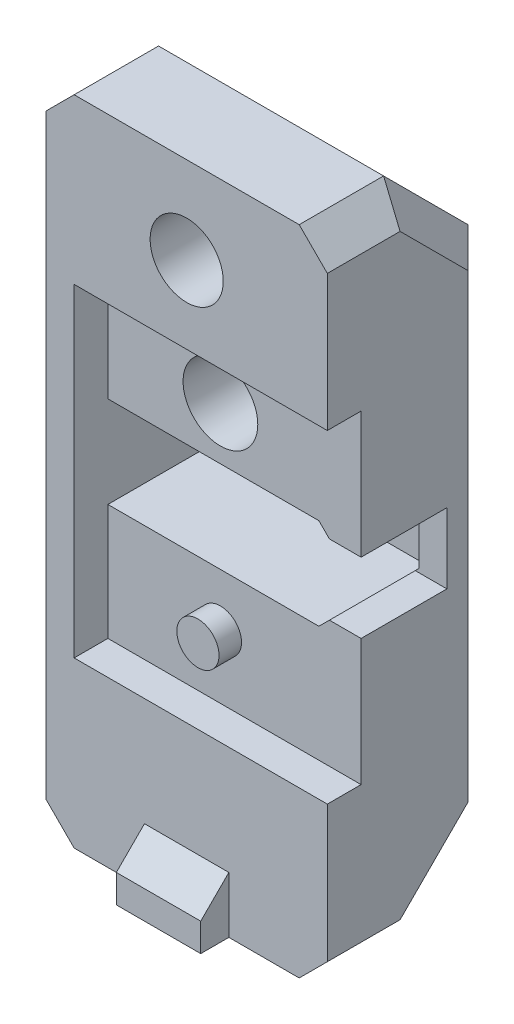
from build123d import *

# Parameters (mm, degrees)
SKETCH1_W            = 20
SKETCH1_H            = 46.382365304
SKETCH1_R            = 2.6
SKETCH1_R_2          = 1.75
SKETCH1_R_3          = 2.75
BOSS_EXTRUDE2_DEPTH  = 2
SKETCH2_R            = 2.6
BOSS_EXTRUDE3_DEPTH  = 10
SKETCH4_R            = 1.75
BOSS_EXTRUDE5_DEPTH  = 2
SKETCH5_R            = 4.5
CUT_EXTRUDE1_DEPTH   = 5
SKETCH3_W            = 18
SKETCH3_H            = 8.25
SKETCH3_R            = 1.75
BOSS_EXTRUDE9_DEPTH  = 7.6
SKETCH8_R            = 2.55
CUT_EXTRUDE3_DEPTH   = 3.8
CHAMFER5_SIZE2       = 3.8
CHAMFER5_SIZE        = 0.105
CHAMFER6_SIZE        = 6
CHAMFER7_SIZE        = 2
SKETCH9_W            = 2
SKETCH9_H            = 6.5
BOSS_EXTRUDE10_DEPTH = 1.5
SKETCH10_W           = 2
SKETCH10_H           = 0.75
BOSS_EXTRUDE11_DEPTH = 6.1
CHAMFER8_SIZE        = 1
SKETCH13_R           = 1.875965007
BOSS_EXTRUDE14_DEPTH = 7.6
SKETCH12_R           = 1.5
BOSS_EXTRUDE15_DEPTH = 1.6
SKETCH14_W           = 6
SKETCH14_H           = 4
BOSS_EXTRUDE16_DEPTH = 2
CHAMFER9_SIZE        = 2


# Some blends are built 0.0001 mm under size
with BuildPart() as part:
    # Sketch1 → Boss-Extrude2 (new body)
    with BuildSketch(Plane.XY):
        with Locations((-1.1970966, -0.016031908)):
            Rectangle(SKETCH1_W, SKETCH1_H)
        with Locations((-1.1970966, 16.983968092)):
            Circle(SKETCH1_R, mode=Mode.SUBTRACT)
        with Locations((-1.1970966, 7)):
            Circle(SKETCH1_R_2, mode=Mode.SUBTRACT)
        with Locations((-1.1970966, 0)):
            Circle(SKETCH1_R_3, mode=Mode.SUBTRACT)
    extrude(amount=BOSS_EXTRUDE2_DEPTH)

    # Sketch2 → Boss-Extrude3 (add)
    with BuildSketch(Plane.XY.offset(2)):
        Polygon((-11.1970966, 23.175150744), (-11.1970966, -23.20721456), (8.8029034, -23.20721456), (8.8029034, -11.5), (-9.1970966, -11.5), (-9.1970966, 11.5), (8.8029034, 11.5), (8.8029034, 23.175150744), align=None)
        with Locations((-1.1970966, 16.983968092)):
            Circle(SKETCH2_R, mode=Mode.SUBTRACT)
    extrude(amount=BOSS_EXTRUDE3_DEPTH)

    # Sketch4 → Boss-Extrude5 (add)
    with BuildSketch(Plane(origin=(0, 0, 0), x_dir=(-1, 0, 0), z_dir=(0, 0, -1))):
        with Locations((1.1970966, 7)):
            Circle(SKETCH4_R)
    extrude(amount=-BOSS_EXTRUDE5_DEPTH)

    # Sketch5 → Cut-Extrude1 (cut)
    with BuildSketch(Plane(origin=(0, 0, 0), x_dir=(-1, 0, 0), z_dir=(0, 0, -1))):
        with Locations((1.1970966, 16.983968092)):
            Circle(SKETCH5_R)
    extrude(amount=-CUT_EXTRUDE1_DEPTH, mode=Mode.SUBTRACT)

    # Sketch3 → Boss-Extrude9 (add)
    # profile 1 of 2: a face of its own
    with BuildSketch(Plane.XY.offset(2)):
        with Locations((-0.1970966, -7.375)):
            Rectangle(SKETCH3_W, SKETCH3_H)
        with Locations(Location((-1.1970966, -7, 0), (0, 0, 180))):
            Circle(SKETCH3_R, mode=Mode.SUBTRACT)
    # profile 2 of 2: a face of its own
    with BuildSketch(Plane.XY.offset(2)):
        with Locations((-0.1970966, 7.375)):
            Rectangle(SKETCH3_W, SKETCH3_H)
        with Locations(Location((-1.1970966, 7, 0), (0, 0, 180))):
            Circle(SKETCH3_R, mode=Mode.SUBTRACT)
    extrude(amount=BOSS_EXTRUDE9_DEPTH)

    # Sketch8 → Cut-Extrude3 (cut)
    with BuildSketch(Plane.XY.offset(9.6)):
        with Locations((-1.1970966, 7)):
            Circle(SKETCH8_R)
    extrude(amount=-CUT_EXTRUDE3_DEPTH, mode=Mode.SUBTRACT)

    # Chamfer5
    chamfer5_edges = [part.edges().sort_by_distance(p)[0] for p in [
        (-3.7470966, 7, 9.6),
    ]]
    chamfer5_side = [part.faces().sort_by_distance(p)[0] for p in [
        (-3.7491966, 7, 9.6),
    ]]
    chamfer(chamfer5_edges, length=CHAMFER5_SIZE - 0.0001, length2=CHAMFER5_SIZE2 - 0.0001, reference=chamfer5_side[0])  # a hair under: the kernel refuses the full size

    # Chamfer6
    # the kernel refuses this chamfer: 6 mm, written as the material it takes off along each edge
    with BuildSketch(Plane(origin=(-26.627194528, 23.175150744, 0), x_dir=(0, 0.027495876610586202, 0.9996219169112968), z_dir=(1, 0, 0)), Plane(origin=(24.233001328, -23.20721456, 0), x_dir=(0, -0.027495876610586202, 0.9996219169112968), z_dir=(-1, 0, 0))) as chamfer6_piece_1:
        Polygon((CHAMFER6_SIZE * 0.999621916911, CHAMFER6_SIZE * 0.0274958766106), (-CHAMFER6_SIZE * 0.0274958766106, CHAMFER6_SIZE * 0.999621916911), (0, 0), align=None)
    extrude(amount=50.860195856, mode=Mode.SUBTRACT)

    # Chamfer7
    chamfer7_edges = [part.edges().sort_by_distance(p)[0] for p in [
        (-11.1970966, -0.016031908, 0),
        (8.8029034, -0.016031908, 0),
        (8.8029034, -20.20721456, 3),
        (8.8029034, 20.175150744, 3),
        (-11.1970966, -20.20721456, 3),
        (-11.1970966, 20.175150744, 3),
        (-11.1970966, -23.20721456, 9),
        (-11.1970966, 23.175150744, 9),
        (8.8029034, 23.175150744, 9),
        (8.8029034, -23.20721456, 9),
    ]]
    chamfer(chamfer7_edges, length=CHAMFER7_SIZE - 0.0001)  # a hair under: the kernel refuses the full size

    # Sketch9 → Boss-Extrude10 (add)
    with BuildSketch(Plane.XY.offset(2)):
        with Locations((7.8029034, 0)):
            Rectangle(SKETCH9_W, SKETCH9_H)
    extrude(amount=BOSS_EXTRUDE10_DEPTH)

    # Sketch10 → Boss-Extrude11 (add)
    with BuildSketch(Plane.XY.offset(3.5)):
        with Locations((7.8029034, 2.875)):
            Rectangle(SKETCH10_W, SKETCH10_H)
        with Locations((7.8029034, -2.875)):
            Rectangle(SKETCH10_W, SKETCH10_H)
    extrude(amount=BOSS_EXTRUDE11_DEPTH)

    # Chamfer8
    chamfer8_edges = [part.edges().sort_by_distance(p)[0] for p in [
        (6.8029034, -3.25, 5.8),
        (6.8029034, 0, 2),
        (6.8029034, 3.25, 5.8),
    ]]
    chamfer(chamfer8_edges, length=CHAMFER8_SIZE)

    # Sketch13 → Boss-Extrude14 (add)
    with BuildSketch(Plane.XY.offset(2)):
        with Locations((-1.1970966, -7)):
            Circle(SKETCH13_R)
    extrude(amount=BOSS_EXTRUDE14_DEPTH)

    # Sketch12 → Boss-Extrude15 (add)
    with BuildSketch(Plane.XY.offset(9.6)):
        with Locations((-1.1970966, -7)):
            Circle(SKETCH12_R)
    extrude(amount=BOSS_EXTRUDE15_DEPTH)

    # Sketch14 → Boss-Extrude16 (add)
    with BuildSketch(Plane.XY.offset(12)):
        with Locations((-1.1970966, -21.20721456)):
            Rectangle(SKETCH14_W, SKETCH14_H)
    extrude(amount=BOSS_EXTRUDE16_DEPTH)

    # Chamfer9
    chamfer9_edges = [part.edges().sort_by_distance(p)[0] for p in [
        (-1.1970966, -19.20721456, 14),
    ]]
    chamfer(chamfer9_edges, length=CHAMFER9_SIZE - 0.0001)  # a hair under: the kernel refuses the full size


solid = part.part
